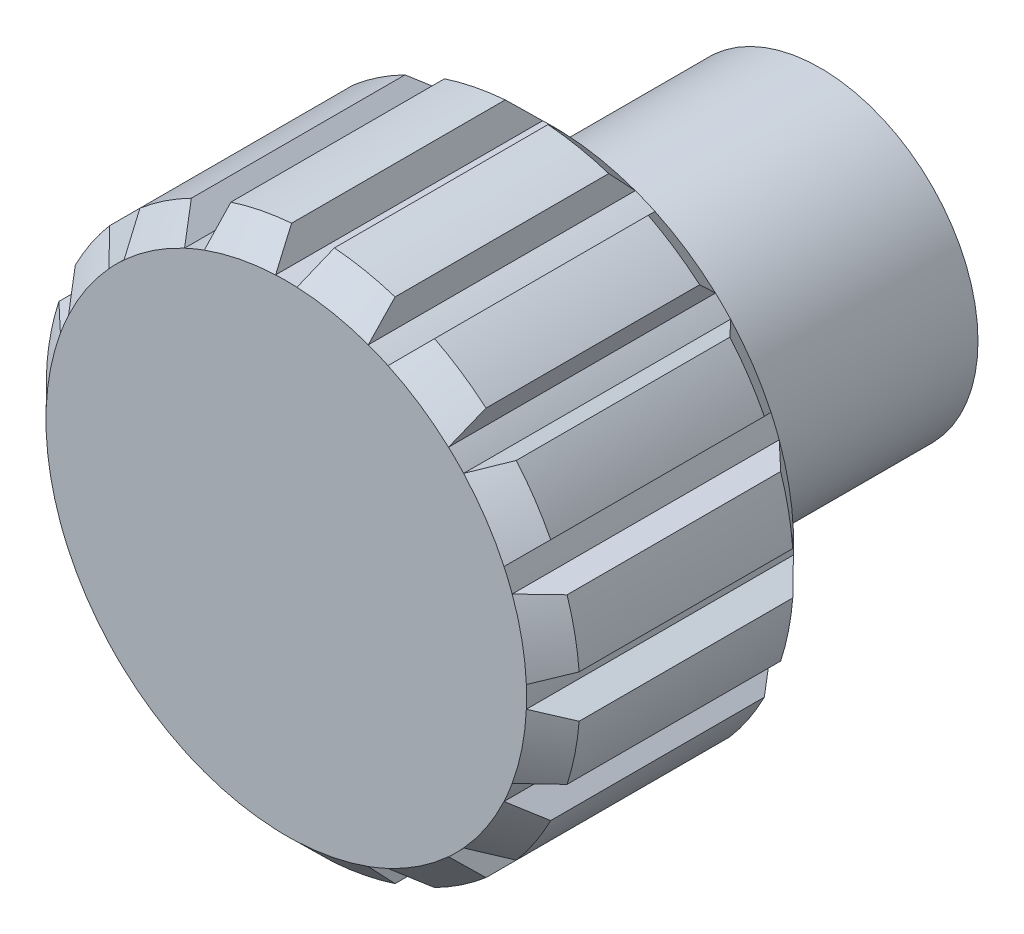
from build123d import *

# Parameters (mm, degrees)
SKETCH1_R           = 7.5
SKETCH1_R_2         = 3.5
BOSS_EXTRUDE1_DEPTH = 12.7
SKETCH2_R           = 12.7
BOSS_EXTRUDE2_DEPTH = 12.7
CHAMFER1_SIZE       = 1.27
CUT_EXTRUDE2_DEPTH  = 12.7


with BuildPart() as part:
    # Sketch1 → Boss-Extrude1 (new body)
    with BuildSketch(Plane.XY):
        Circle(SKETCH1_R)
        Circle(SKETCH1_R_2, mode=Mode.SUBTRACT)
    extrude(amount=BOSS_EXTRUDE1_DEPTH)

    # Sketch2 → Boss-Extrude2 (add)
    with BuildSketch(Plane.XY.offset(12.7)):
        Circle(SKETCH2_R)
    extrude(amount=BOSS_EXTRUDE2_DEPTH)

    # Chamfer1
    chamfer1_edges = [part.edges().sort_by_distance(p)[0] for p in [
        (-12.7, 0, 25.4),
        (-12.7, 0, 12.7),
    ]]
    chamfer(chamfer1_edges, length=CHAMFER1_SIZE)

    # Sketch3 → Cut-Extrude2 (cut)
    with BuildSketch(Plane.XY.offset(25.4)):
        with BuildLine():
            Line((-1.494578623, 13.823081897), (-0.508, 11.418705531))
            ThreePointArc((-0.508, 11.418705531), (0, 11.43), (0.508, 11.418705531))
            Line((0.508, 11.418705531), (1.494578623, 13.823081897))
            Line((1.494578623, 13.823081897), (-1.494578623, 13.823081897))
        make_face()
        with BuildLine():
            Line((3.909053826, 13.342812918), (6.670675026, 12.198911963))
            Line((6.670675026, 12.198911963), (4.839080228, 10.355105144))
            ThreePointArc((4.839080228, 10.355105144), (4.374071632, 10.559943057), (3.900418623, 10.743911511))
            Line((3.900418623, 10.743911511), (3.909053826, 13.342812918))
        make_face()
        with BuildLine():
            Line((8.717568266, 10.831221626), (10.831221626, 8.717568266))
            Line((10.831221626, 8.717568266), (8.433454358, 7.715033868))
            ThreePointArc((8.433454358, 7.715033868), (8.082230509, 8.082230509), (7.715033868, 8.433454358))
            Line((7.715033868, 8.433454358), (8.717568266, 10.831221626))
        make_face()
        with BuildLine():
            Line((12.198911963, 6.670675026), (13.342812918, 3.909053826))
            Line((13.342812918, 3.909053826), (10.743911511, 3.900418623))
            ThreePointArc((10.743911511, 3.900418623), (10.559943057, 4.374071632), (10.355105144, 4.839080228))
            Line((10.355105144, 4.839080228), (12.198911963, 6.670675026))
        make_face()
        with BuildLine():
            Line((13.823081897, 1.494578623), (13.823081897, -1.494578623))
            Line((13.823081897, -1.494578623), (11.418705531, -0.508))
            ThreePointArc((11.418705531, -0.508), (11.43, 0), (11.418705531, 0.508))
            Line((11.418705531, 0.508), (13.823081897, 1.494578623))
        make_face()
        with BuildLine():
            Line((13.342812918, -3.909053826), (12.198911963, -6.670675026))
            Line((12.198911963, -6.670675026), (10.355105144, -4.839080228))
            ThreePointArc((10.355105144, -4.839080228), (10.559943057, -4.374071632), (10.743911511, -3.900418623))
            Line((10.743911511, -3.900418623), (13.342812918, -3.909053826))
        make_face()
        with BuildLine():
            Line((10.831221626, -8.717568266), (8.717568266, -10.831221626))
            Line((8.717568266, -10.831221626), (7.715033868, -8.433454358))
            ThreePointArc((7.715033868, -8.433454358), (8.082230509, -8.082230509), (8.433454358, -7.715033868))
            Line((8.433454358, -7.715033868), (10.831221626, -8.717568266))
        make_face()
        with BuildLine():
            Line((6.670675026, -12.198911963), (3.909053826, -13.342812918))
            Line((3.909053826, -13.342812918), (3.900418623, -10.743911511))
            ThreePointArc((3.900418623, -10.743911511), (4.374071632, -10.559943057), (4.839080228, -10.355105144))
            Line((4.839080228, -10.355105144), (6.670675026, -12.198911963))
        make_face()
        with BuildLine():
            Line((1.494578623, -13.823081897), (-1.494578623, -13.823081897))
            Line((-1.494578623, -13.823081897), (-0.508, -11.418705531))
            ThreePointArc((-0.508, -11.418705531), (0, -11.43), (0.508, -11.418705531))
            Line((0.508, -11.418705531), (1.494578623, -13.823081897))
        make_face()
        with BuildLine():
            Line((-3.909053826, -13.342812918), (-6.670675026, -12.198911963))
            Line((-6.670675026, -12.198911963), (-4.839080228, -10.355105144))
            ThreePointArc((-4.839080228, -10.355105144), (-4.374071632, -10.559943057), (-3.900418623, -10.743911511))
            Line((-3.900418623, -10.743911511), (-3.909053826, -13.342812918))
        make_face()
        with BuildLine():
            Line((-8.717568266, -10.831221626), (-10.831221626, -8.717568266))
            Line((-10.831221626, -8.717568266), (-8.433454358, -7.715033868))
            ThreePointArc((-8.433454358, -7.715033868), (-8.082230509, -8.082230509), (-7.715033868, -8.433454358))
            Line((-7.715033868, -8.433454358), (-8.717568266, -10.831221626))
        make_face()
        with BuildLine():
            Line((-12.198911963, -6.670675026), (-13.342812918, -3.909053826))
            Line((-13.342812918, -3.909053826), (-10.743911511, -3.900418623))
            ThreePointArc((-10.743911511, -3.900418623), (-10.559943057, -4.374071632), (-10.355105144, -4.839080228))
            Line((-10.355105144, -4.839080228), (-12.198911963, -6.670675026))
        make_face()
        with BuildLine():
            Line((-13.823081897, -1.494578623), (-13.823081897, 1.494578623))
            Line((-13.823081897, 1.494578623), (-11.418705531, 0.508))
            ThreePointArc((-11.418705531, 0.508), (-11.43, 0), (-11.418705531, -0.508))
            Line((-11.418705531, -0.508), (-13.823081897, -1.494578623))
        make_face()
        with BuildLine():
            Line((-13.342812918, 3.909053826), (-12.198911963, 6.670675026))
            Line((-12.198911963, 6.670675026), (-10.355105144, 4.839080228))
            ThreePointArc((-10.355105144, 4.839080228), (-10.559943057, 4.374071632), (-10.743911511, 3.900418623))
            Line((-10.743911511, 3.900418623), (-13.342812918, 3.909053826))
        make_face()
        with BuildLine():
            Line((-10.831221626, 8.717568266), (-8.717568266, 10.831221626))
            Line((-8.717568266, 10.831221626), (-7.715033868, 8.433454358))
            ThreePointArc((-7.715033868, 8.433454358), (-8.082230509, 8.082230509), (-8.433454358, 7.715033868))
            Line((-8.433454358, 7.715033868), (-10.831221626, 8.717568266))
        make_face()
        with BuildLine():
            Line((-6.670675026, 12.198911963), (-3.909053826, 13.342812918))
            Line((-3.909053826, 13.342812918), (-3.900418623, 10.743911511))
            ThreePointArc((-3.900418623, 10.743911511), (-4.374071632, 10.559943057), (-4.839080228, 10.355105144))
            Line((-4.839080228, 10.355105144), (-6.670675026, 12.198911963))
        make_face()
    extrude(amount=-CUT_EXTRUDE2_DEPTH, mode=Mode.SUBTRACT)


solid = part.part
